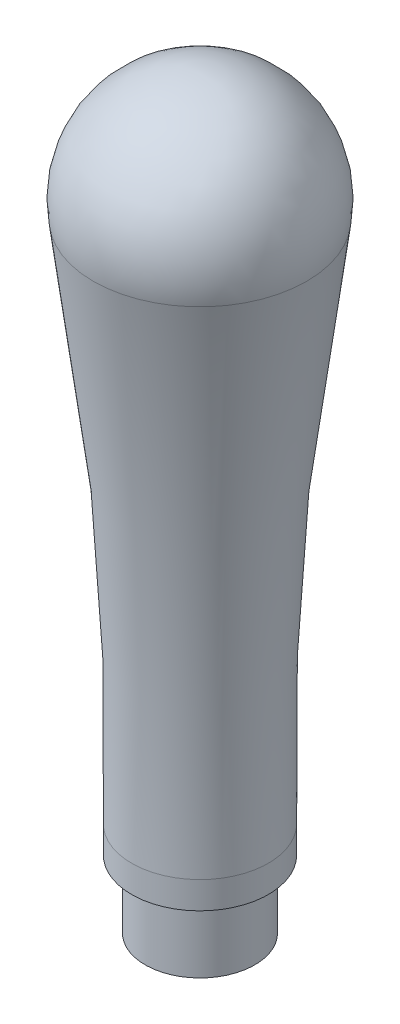
from build123d import *

# Parameters (mm, degrees)
CHAMFER1_SIZE2 = 1
CHAMFER1_SIZE  = 0.577350269


with BuildPart() as part:
    # Sketch1 → Revolve1 (revolve)
    with BuildSketch(Plane.XY, mode=Mode.PRIVATE) as revolve1_sk:
        with BuildLine():
            Line((0, 0), (4.05, 0))
            Line((4.05, 0), (4.05, 5))
            Line((4.05, 5), (5.05, 5))
            Line((5.05, 5), (5.05, 7))
            ThreePointArc((5.05, 7), (5.529083978, 26.391142635), (7.88435805, 45.644677848))
            ThreePointArc((7.88435805, 45.644677848), (6.117294223, 52.155454528), (0, 55))
            Line((0, 55), (0, 0))
        make_face()
    revolve(revolve1_sk.sketch.rotate(Axis((0, 55, 0), (0, -1, 0)), 180), axis=Axis((0, 55, 0), (0, -1, 0)))

    # Chamfer1
    chamfer1_edges = [part.edges().sort_by_distance(p)[0] for p in [
        (4.05, 5, 0),
    ]]
    chamfer1_side = [part.faces().sort_by_distance(p)[0] for p in [
        (4.05, 4.988452995, 0),
    ]]
    chamfer(chamfer1_edges, length=CHAMFER1_SIZE - 0.0001, length2=CHAMFER1_SIZE2 - 0.0001, reference=chamfer1_side[0])  # a hair under: the kernel refuses the full size


solid = part.part
